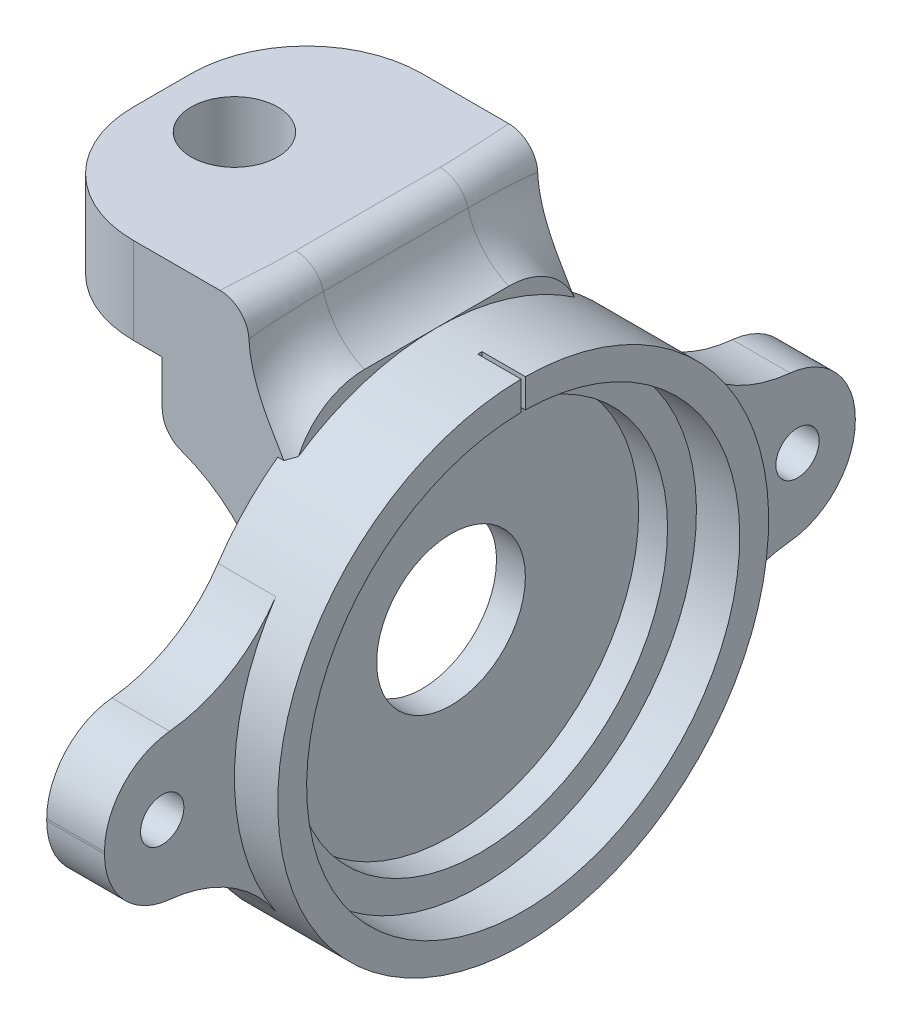
from build123d import *

# Parameters (mm, degrees)
SKETCH_1_R          = 17
EXTRUDE_1_DEPTH     = 7
EXTRUDE_2_DEPTH     = 4
SKETCH_2_R          = 15
CUT_EXTRUDE_1_DEPTH = 3
CUT_EXTRUDE_2_REACH = 33.321
SKETCH_3_R          = 5.15
SKETCH_4_R          = 13
CUT_EXTRUDE_3_DEPTH = 2
CUT_EXTRUDE_4_REACH = 33.321
SKETCH_6_R          = 1.5
FILLET_1_R          = 10
FILLET_2_R          = 5
SKETCH_8_W          = 0.3
SKETCH_8_H          = 2.22932804
CUT_EXTRUDE_5_DEPTH = 3
SKETCH_9_W          = 20
SKETCH_9_H          = 2.594823192
EXTRUDE_3_DEPTH     = 8
SKETCH_10_W         = 5.99596414
SKETCH_10_H         = 20
EXTRUDE_4_DEPTH     = 8
SKETCH_11_W         = 20
SKETCH_11_H         = 6
EXTRUDE_5_DEPTH     = 10
SKETCH_12_R         = 3
CUT_EXTRUDE_6_DEPTH = 10
FILLET_3_R          = 10
EXTRUDE_6_DEPTH     = 3
FILLET_5_R          = 5
FILLET_6_R          = 5
FILLET_7_R          = 8
FILLET_9_R          = 2


with BuildPart() as part:
    # 草图1 → 凸台-拉伸1 (new body)
    with BuildSketch(Plane(origin=(0, 0, 0), x_dir=(0, 0, -1), z_dir=(1, 0, 0))):
        Circle(SKETCH_1_R)
    extrude(amount=EXTRUDE_1_DEPTH)

    # 草图5 → 凸台-拉伸2 (add)
    with BuildSketch(Plane.ZY):
        Polygon((0, 5.000073493), (26, 5.000073493), (26, -4.999926507), (11, -4.999926507), (-26, -4.999926507), (-26, 5.000073493), align=None)
    extrude(amount=-EXTRUDE_2_DEPTH)

    # 草图2 → 切除-拉伸1 (cut)
    with BuildSketch(Plane(origin=(7, 0, 0), x_dir=(0, 0, -1), z_dir=(1, 0, 0))):
        Circle(SKETCH_2_R)
    extrude(amount=-CUT_EXTRUDE_1_DEPTH, mode=Mode.SUBTRACT)

    # 草图3 → 切除-拉伸2 (cut, up to next)
    with BuildSketch(Plane(origin=(4, 0, 0), x_dir=(0, 0, -1), z_dir=(1, 0, 0)), mode=Mode.PRIVATE) as cut_extrude_2_sk1:
        Circle(SKETCH_3_R)
    cut_extrude_2_tool1 = extrude(cut_extrude_2_sk1.sketch, amount=-CUT_EXTRUDE_2_REACH, mode=Mode.PRIVATE) & part.part
    add(cut_extrude_2_tool1.solids().sort_by_distance((4, 0, 0))[0], mode=Mode.SUBTRACT)

    # 草图4 → 切除-拉伸3 (cut)
    with BuildSketch(Plane(origin=(4, 0, 0), x_dir=(0, 0, -1), z_dir=(1, 0, 0))):
        Circle(SKETCH_4_R)
    extrude(amount=-CUT_EXTRUDE_3_DEPTH, mode=Mode.SUBTRACT)

    # 草图6 → 切除-拉伸4 (cut, up to next)
    with BuildSketch(Plane(origin=(4, 0, 0), x_dir=(0, 0, -1), z_dir=(1, 0, 0)), mode=Mode.PRIVATE) as cut_extrude_4_sk1:
        with Locations((-22, 7.3493e-05)):
            Circle(SKETCH_6_R)
    cut_extrude_4_tool1 = extrude(cut_extrude_4_sk1.sketch, amount=-CUT_EXTRUDE_4_REACH, mode=Mode.PRIVATE) & part.part
    # 草图6 → 切除-拉伸4 (cut, up to next)
    with BuildSketch(Plane(origin=(4, 0, 0), x_dir=(0, 0, -1), z_dir=(1, 0, 0)), mode=Mode.PRIVATE) as cut_extrude_4_sk2:
        with Locations((22, 7.3493e-05)):
            Circle(SKETCH_6_R)
    cut_extrude_4_tool2 = extrude(cut_extrude_4_sk2.sketch, amount=-CUT_EXTRUDE_4_REACH, mode=Mode.PRIVATE) & part.part
    add(cut_extrude_4_tool1.solids().sort_by_distance((4, 7.3e-05, 22))[0], mode=Mode.SUBTRACT)
    add(cut_extrude_4_tool2.solids().sort_by_distance((4, 7.3e-05, -22))[0], mode=Mode.SUBTRACT)

    # 圆角1
    fillet_1_edges = [part.edges().sort_by_distance(p)[0] for p in [
        (2, 5.000073493, -16.248054193),
        (2, 5.000073493, 16.248054193),
        (2, -4.999926507, 16.248099425),
        (2, -4.999926507, -16.248099425),
    ]]
    fillet(fillet_1_edges, radius=FILLET_1_R)

    # 圆角2
    fillet_2_edges = [part.edges().sort_by_distance(p)[0] for p in [
        (2, 5.000073493, 26),
        (2, -4.999926507, 26),
        (2, -4.999926507, -26),
        (2, 5.000073493, -26),
    ]]
    fillet(fillet_2_edges, radius=FILLET_2_R)

    # 草图8 → 切除-拉伸5 (cut)
    with BuildSketch(Plane(origin=(7, 0, 0), x_dir=(0, 0, -1), z_dir=(1, 0, 0))):
        with Locations((0, 16.113914001)):
            Rectangle(SKETCH_8_W, SKETCH_8_H)
    extrude(amount=-CUT_EXTRUDE_5_DEPTH, mode=Mode.SUBTRACT)

    # 草图9 → 凸台-拉伸3 (add)
    with BuildSketch(Plane.ZY):
        with Locations((0, 12.450315489)):
            Rectangle(SKETCH_9_W, SKETCH_9_H)
    extrude(amount=EXTRUDE_3_DEPTH)

    # 草图10 → 凸台-拉伸4 (add)
    with BuildSketch(Plane(origin=(0, 13.747727085, 0), x_dir=(1, 0, 0), z_dir=(0, 1, 0))):
        with Locations((-5.00201793, 0)):
            Rectangle(SKETCH_10_W, SKETCH_10_H)
    extrude(amount=EXTRUDE_4_DEPTH)

    # 草图11 → 凸台-拉伸5 (add)
    with BuildSketch(Plane.ZY.offset(8)):
        with Locations((0, 18.747727085)):
            Rectangle(SKETCH_11_W, SKETCH_11_H)
    extrude(amount=EXTRUDE_5_DEPTH)

    # 草图12 → 切除-拉伸6 (cut)
    with BuildSketch(Plane(origin=(0, 21.747727085, 0), x_dir=(1, 0, 0), z_dir=(0, 1, 0))):
        with Locations(Location((-13, 0, 0), (0, 0, 270))):
            Circle(SKETCH_12_R)
    extrude(amount=-CUT_EXTRUDE_6_DEPTH, mode=Mode.SUBTRACT)

    # 圆角3
    # the kernel refuses this fillet: 10 mm, written as the material it adds along each edge
    with BuildSketch(Plane(origin=(0, 11.152903893, 10), x_dir=(0, -1, 0), z_dir=(0, 0, -1))) as fillet_3_piece_1_section:
        with BuildLine():
            CenterArc((9.797958971, 10), FILLET_3_R, 191.536959033, 78.463040967)
            Line((0, 8), (0, 0))
            Line((0, 0), (9.797958971, 0))
        make_face()
    fillet_3_piece_1 = extrude(amount=20, mode=Mode.PRIVATE)
    fillet_3_piece_1 = fillet_3_piece_1 - Plane(origin=(0, 0, 0), x_dir=(0, 0, -1), z_dir=(1, 0, 0)) * Cylinder(5.15, 80, mode=Mode.PRIVATE)
    add(fillet_3_piece_1)

    # 草图13 → 凸台-拉伸6 (add)
    with BuildSketch(Plane(origin=(-2.00403586, 0, 0), x_dir=(0, 0, -1), z_dir=(1, 0, 0))):
        Polygon((0, 17), (10, 17), (10, 13.747727085), (-10, 13.747727085), (-10, 17), align=None)
    extrude(amount=EXTRUDE_6_DEPTH)

    # 圆角5
    # the kernel refuses this fillet: 5 mm, written as the material it takes off along each edge
    with BuildSketch(Plane(origin=(-2.00403586, 17, -10), x_dir=(0, -1, 0), z_dir=(1, 0, 0))) as fillet_5_piece_1_section:
        with BuildLine():
            CenterArc((FILLET_5_R, -FILLET_5_R), FILLET_5_R, 90, 90)
            Line((0, -FILLET_5_R), (0, 0))
            Line((0, 0), (FILLET_5_R, 0))
        make_face()
    fillet_5_piece_1 = extrude(amount=15.5, mode=Mode.PRIVATE)
    fillet_5_piece_1 = split(fillet_5_piece_1, bisect_by=Plane(origin=(0, 17, -10), z_dir=(-1, 0, 0)), keep=Keep.TOP, mode=Mode.PRIVATE)
    add(fillet_5_piece_1, mode=Mode.SUBTRACT)
    with BuildSketch(Plane(origin=(-2.00403586, 17, -10), x_dir=(0, -1, 0), z_dir=(1, 0, 0))) as fillet_5_piece_2_section:
        with BuildLine():
            CenterArc((FILLET_5_R, -FILLET_5_R), FILLET_5_R, 90, 90)
            Line((0, -FILLET_5_R), (0, 0))
            Line((0, 0), (FILLET_5_R, 0))
        make_face()
    fillet_5_piece_2 = extrude(amount=15.5, mode=Mode.PRIVATE)
    fillet_5_piece_2 = fillet_5_piece_2 - Plane(origin=(-2.00403586, 0, 0), x_dir=(0, 0, -1), z_dir=(-1, 0, 0)) * Cylinder(17, 51, mode=Mode.PRIVATE)
    add(fillet_5_piece_2, mode=Mode.SUBTRACT)
    with BuildSketch(Plane(origin=(-2.00403586, 17, 10), x_dir=(0, -1, 0), z_dir=(1, 0, 0))) as fillet_5_piece_3_section:
        with BuildLine():
            CenterArc((FILLET_5_R, FILLET_5_R), FILLET_5_R, 180, 90)
            Line((0, FILLET_5_R), (0, 0))
            Line((0, 0), (FILLET_5_R, 0))
        make_face()
    fillet_5_piece_3 = extrude(amount=15.5, mode=Mode.PRIVATE)
    fillet_5_piece_3 = split(fillet_5_piece_3, bisect_by=Plane(origin=(0, 17, 10), z_dir=(-1, 0, 0)), keep=Keep.TOP, mode=Mode.PRIVATE)
    add(fillet_5_piece_3, mode=Mode.SUBTRACT)
    with BuildSketch(Plane(origin=(-2.00403586, 17, 10), x_dir=(0, -1, 0), z_dir=(1, 0, 0))) as fillet_5_piece_4_section:
        with BuildLine():
            CenterArc((FILLET_5_R, FILLET_5_R), FILLET_5_R, 180, 90)
            Line((0, FILLET_5_R), (0, 0))
            Line((0, 0), (FILLET_5_R, 0))
        make_face()
    fillet_5_piece_4 = extrude(amount=15.5, mode=Mode.PRIVATE)
    fillet_5_piece_4 = fillet_5_piece_4 - Plane(origin=(-2.00403586, 0, 0), x_dir=(0, 0, -1), z_dir=(-1, 0, 0)) * Cylinder(17, 51, mode=Mode.PRIVATE)
    add(fillet_5_piece_4, mode=Mode.SUBTRACT)

    # 圆角6
    # the kernel refuses this fillet: 5 mm, written as the material it adds along each edge
    with BuildSketch(Plane(origin=(-2.00403586, 12, -5), x_dir=(0, 1, 0), z_dir=(0, 0, 1))) as fillet_6_piece_1_section:
        with BuildLine():
            CenterArc((9.582575695, -5), FILLET_6_R, 90, 66.421821522)
            Line((5, -3), (5, 0))
            Line((5, 0), (9.582575695, 0))
        make_face()
    fillet_6_piece_1 = revolve(axis=Axis((-2.00403586, 12, -5), (-1, 0, 0)), revolution_arc=221.333860008, mode=Mode.PRIVATE)
    fillet_6_piece_1 = fillet_6_piece_1 - Plane(origin=(-10, 1.354944922, -5), x_dir=(0, -1, 0), z_dir=(0, 0, 1)) * Cylinder(10, 39, mode=Mode.PRIVATE)
    fillet_6_piece_1 = split(fillet_6_piece_1, bisect_by=Plane(origin=(-2.00403586, 12, -10), z_dir=(0, 0, 1)), keep=Keep.TOP, mode=Mode.PRIVATE)
    add(fillet_6_piece_1)
    with BuildSketch(Plane(origin=(-2.00403586, 12, 5), x_dir=(0, 1, 0), z_dir=(0, 0, -1))) as fillet_6_piece_2_section:
        with BuildLine():
            CenterArc((9.582575695, 5), FILLET_6_R, 203.578178478, 66.421821522)
            Line((5, 3), (5, 0))
            Line((5, 0), (9.582575695, 0))
        make_face()
    fillet_6_piece_2 = revolve(axis=Axis((-2.00403586, 12, 5), (1, 0, 0)), revolution_arc=221.333860008, mode=Mode.PRIVATE)
    fillet_6_piece_2 = fillet_6_piece_2 - Plane(origin=(-10, 1.354944922, 5), x_dir=(0, -1, 0), z_dir=(0, 0, 1)) * Cylinder(10, 39, mode=Mode.PRIVATE)
    fillet_6_piece_2 = split(fillet_6_piece_2, bisect_by=Plane(origin=(-2.00403586, 12, 10), z_dir=(0, 0, -1)), keep=Keep.TOP, mode=Mode.PRIVATE)
    add(fillet_6_piece_2)
    with BuildSketch(Plane(origin=(-2.00403586, 17, -5), x_dir=(0, 1, 0), z_dir=(0, 0, 1))) as fillet_6_piece_3:
        with BuildLine():
            CenterArc((4.582575695, -5), FILLET_6_R, 90, 66.421821522)
            Line((0, -3), (0, 0))
            Line((0, 0), (4.582575695, 0))
        make_face()
    extrude(amount=10)

    # 圆角7
    fillet_7_edges = [part.edges().sort_by_distance(p)[0] for p in [
        (-18, 18.747727085, -10),
        (-18, 18.747727085, 10),
    ]]
    fillet(fillet_7_edges, radius=FILLET_7_R)

    # 圆角9
    fillet_9_edges = [part.edges().sort_by_distance(p)[0] for p in [
        (-2.00403586, 21.747727085, 0),
        (-8, 11.152903893, 0),
    ]]
    fillet(fillet_9_edges, radius=FILLET_9_R)


solid = part.part
